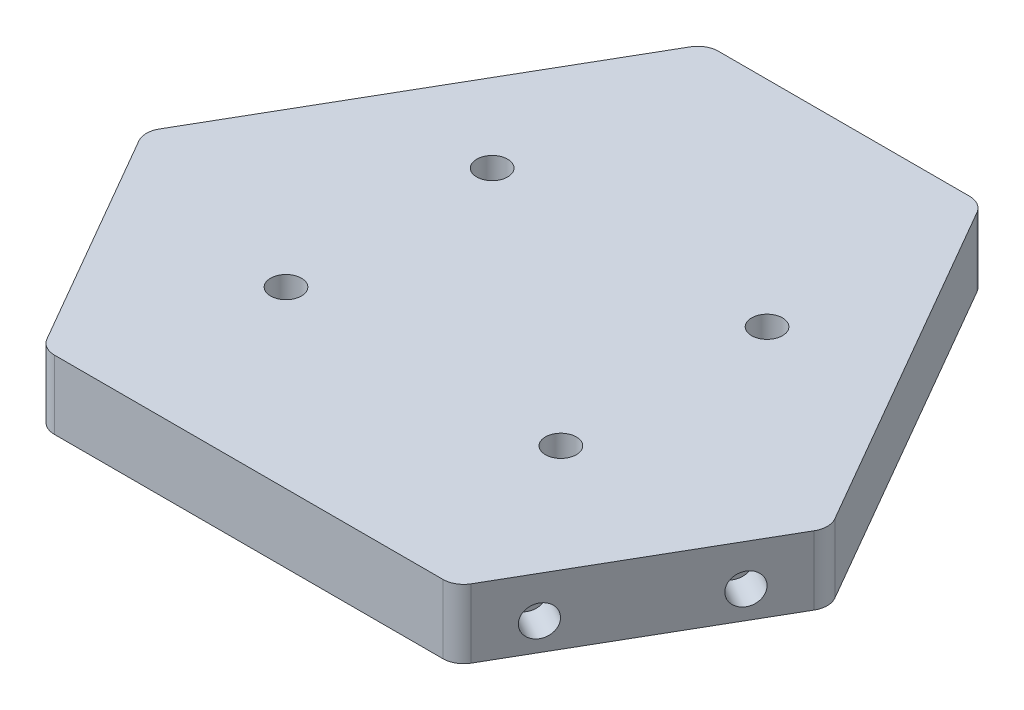
from build123d import *

# Parameters (mm, degrees)
BOSS_EXTRUDE1_DEPTH     = 5
CHAMFER1_SIZE           = 40
SKETCH4_R               = 1.5
CUT_EXTRUDE1_DEPTH      = 10
SKETCH10_R              = 2.25
CUT_EXTRUDE3_DEPTH      = 5
CRVPATTERN1_START       = -46.188021535
CRVPATTERN1_OUTLINE_R   = 2.25
CRVPATTERN1_DEPTH       = 5
CRVPATTERN1_START_2     = -41.188021535
CRVPATTERN1_2_OUTLINE_R = 1.5
CRVPATTERN1_2_DEPTH     = 5
CRVPATTERN1_3_OUTLINE_R = 2.25
CRVPATTERN1_3_DEPTH     = 5
CRVPATTERN1_4_OUTLINE_R = 1.5
CRVPATTERN1_4_DEPTH     = 5
F_3_0MM_DOWEL_HOLE1_D   = 3
SKETCH9_R               = 2.25
CUT_EXTRUDE2_DEPTH      = 5
FILLET1_R               = 3


# Read off the part's stored shape, not the designer's step: CrvPattern1
with BuildPart() as part:
    # Sketch2 → Boss-Extrude1 (new, symmetric)
    with BuildSketch(Plane(origin=(0, 0, 0), x_dir=(1, 0, 0), z_dir=(0, 1, 0))):
        Polygon((70, -40.414518843), (0, 80.829037687), (-70, -40.414518843), align=None)
    extrude(amount=BOSS_EXTRUDE1_DEPTH, both=True)

    # Chamfer1
    chamfer1_edges = [part.edges().sort_by_distance(p)[0] for p in [
        (-70, 0, 40.414518843),
        (0, 0, -80.829037687),
        (70, 0, 40.414518843),
    ]]
    chamfer(chamfer1_edges, length=CHAMFER1_SIZE)

    # Sketch4 → Cut-Extrude1 (cut)
    with BuildSketch(Plane(origin=(40, 0, 23.094010768), x_dir=(0.5000000000000004, 0, -0.8660254037844384), z_dir=(0.8660254037844384, 0, 0.5000000000000004))):
        with Locations((-11, -1)):
            Circle(SKETCH4_R)
        with Locations((11, -1)):
            Circle(SKETCH4_R)
    extrude(amount=-CUT_EXTRUDE1_DEPTH, mode=Mode.SUBTRACT)

    # Sketch10 → Cut-Extrude3 (cut)
    with BuildSketch(Plane(origin=(40, 0, 23.094010768), x_dir=(0.4999999999999997, 0, -0.8660254037844388), z_dir=(0.8660254037844389, 0, 0.49999999999999983))):
        with Locations((-11, -1)):
            Circle(SKETCH10_R)
        with Locations((11, -1)):
            Circle(SKETCH10_R)
    extrude(amount=-CUT_EXTRUDE3_DEPTH, mode=Mode.SUBTRACT)

    # CrvPattern1 outline → CrvPattern1 (cut)
    with BuildSketch(Plane.XY.offset(CRVPATTERN1_START)):
        with Locations((11, -1)):
            Circle(CRVPATTERN1_OUTLINE_R)
        with Locations((-11, -1)):
            Circle(CRVPATTERN1_OUTLINE_R)
    extrude(amount=CRVPATTERN1_DEPTH, mode=Mode.SUBTRACT)

    # CrvPattern1 2 outline → CrvPattern1 2 (cut)
    with BuildSketch(Plane.XY.offset(CRVPATTERN1_START_2)):
        with Locations((11, -1)):
            Circle(CRVPATTERN1_2_OUTLINE_R)
        with Locations((-11, -1)):
            Circle(CRVPATTERN1_2_OUTLINE_R)
    extrude(amount=CRVPATTERN1_2_DEPTH, mode=Mode.SUBTRACT)

    # CrvPattern1 3 outline → CrvPattern1 3 (cut)
    with BuildSketch(Plane(origin=(0, 0, 0), x_dir=(0.500000000000013, 0, 0.8660254037844313), z_dir=(0.8660254037844312, 0, -0.5000000000000131)).offset(CRVPATTERN1_START)):
        with Locations((-11, 1)):
            Circle(CRVPATTERN1_3_OUTLINE_R)
        with Locations((11, 1)):
            Circle(CRVPATTERN1_3_OUTLINE_R)
    extrude(amount=CRVPATTERN1_3_DEPTH, mode=Mode.SUBTRACT)

    # CrvPattern1 4 outline → CrvPattern1 4 (cut)
    with BuildSketch(Plane(origin=(0, 0, 0), x_dir=(0.500000000000013, 0, 0.8660254037844313), z_dir=(0.8660254037844312, 0, -0.5000000000000131)).offset(CRVPATTERN1_START_2)):
        with Locations((-11, 1)):
            Circle(CRVPATTERN1_4_OUTLINE_R)
        with Locations((11, 1)):
            Circle(CRVPATTERN1_4_OUTLINE_R)
    extrude(amount=CRVPATTERN1_4_DEPTH, mode=Mode.SUBTRACT)

    # Ø3.0mm Dowel Hole1 (through all)
    with Locations(Plane(origin=(0, 5, 0), x_dir=(1, 0, 0), z_dir=(0, 1, 0))):
        with Locations((-20, 15), (20, 15), (20, -15), (-20, -15)):
            Hole(F_3_0MM_DOWEL_HOLE1_D / 2)

    # Sketch9 → Cut-Extrude2 (cut)
    with BuildSketch(Plane(origin=(0, 5, 0), x_dir=(1, 0, 0), z_dir=(0, 1, 0))):
        with Locations(Location((-20, 15, 0), (0, 0, 270))):
            Circle(SKETCH9_R)
        with Locations(Location((20, 15, 0), (0, 0, 270))):
            Circle(SKETCH9_R)
        with Locations(Location((20, -15, 0), (0, 0, 270))):
            Circle(SKETCH9_R)
        with Locations(Location((-20, -15, 0), (0, 0, 270))):
            Circle(SKETCH9_R)
    extrude(amount=-CUT_EXTRUDE2_DEPTH, mode=Mode.SUBTRACT)

    # Fillet1
    fillet1_edges = [part.edges().sort_by_distance(p)[0] for p in [
        (20, 0, -46.188021535),
        (50, 0, 5.773502692),
        (-30, 0, 40.414518843),
        (30, 0, 40.414518843),
        (-50, 0, 5.773502692),
        (-20, 0, -46.188021535),
    ]]
    fillet(fillet1_edges, radius=FILLET1_R)


solid = part.part
